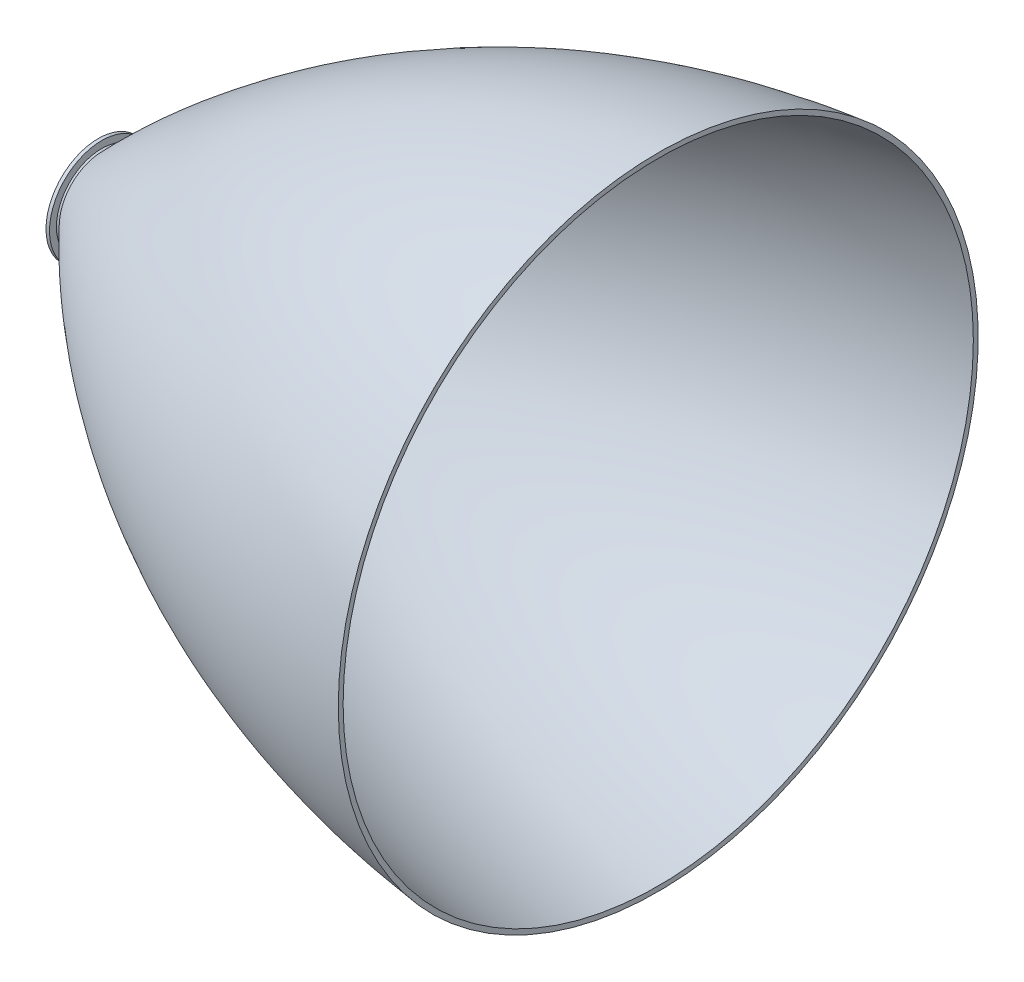
from build123d import *

# Parameters (mm, degrees)
SKETCH4_W           = 2299.140163329
SKETCH4_H           = 1084.867048291
CUT_EXTRUDE1_DEPTH  = 554.228
SKETCH5_R           = 95.504801646
SKETCH5_R_2         = 82.804801646
BOSS_EXTRUDE1_DEPTH = 6.35


with BuildPart() as part:
    # Sketch1 → Revolve3 (revolve)
    with BuildSketch(Plane.XY):
        with BuildLine():
            Line((1016, 576), (1016, 584.89))
            add(Edge.make_bspline(
                [(0, 78.994), (417.258608983, 516.007210788), (1016, 584.89)],
                knots=[0, 0, 0, 1, 1, 1], degree=2))
            add(Edge.make_bspline(
                [(0, 78.994), (-192.730394607, 176.706088879), (-412.824178468, 153.699870936)],
                knots=[0, 0, 0, 1, 1, 1], degree=2))
            Line((-412.824178468, 153.699870936), (-412.824178468, 144.809870936))
            add(Edge.make_bspline(
                [(0, 70.104), (-195.449728047, 157.410787998), (-412.824178468, 144.809870936)],
                knots=[0, 0, 0, 1, 1, 1], degree=2))
            add(Edge.make_bspline(
                [(0, 70.104), (423.605712895, 493.669155738), (1016, 576)],
                knots=[0, 0, 0, 1, 1, 1], degree=2))
        make_face()
    revolve(axis=Axis((-1229.828239288, 0, 0), (1, 0, 0)))

    # Sketch4 → Cut-Extrude1 (cut)
    with BuildSketch(Plane.ZY.offset(7.62)):
        with Locations((-63.658537287, 96.480710784)):
            Rectangle(SKETCH4_W, SKETCH4_H)
    extrude(amount=CUT_EXTRUDE1_DEPTH, mode=Mode.SUBTRACT)


with BuildPart() as body_2:
    # Sketch5 → Boss-Extrude1 (new body)
    with BuildSketch(Plane.ZY.offset(7.62)):
        Circle(SKETCH5_R)
        Circle(SKETCH5_R_2, mode=Mode.SUBTRACT)
    extrude(amount=-BOSS_EXTRUDE1_DEPTH)


solid = Compound([part.part, body_2.part])
